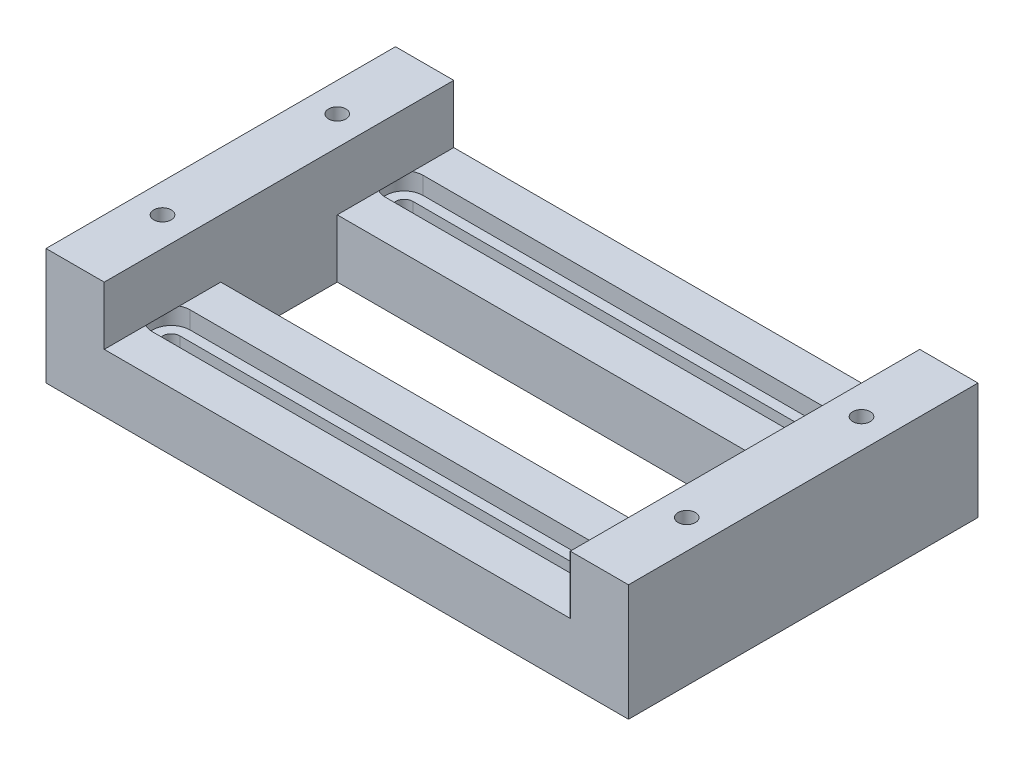
from build123d import *

# Parameters (mm, degrees)
SKETCH1_R             = 1.5
BOSS_EXTRUDE1_DEPTH   = 10
CUT_SLOT_INSETS_DEPTH = 3
SKETCH5_W             = 10
SKETCH5_H             = 60
SKETCH5_R             = 1.5
BOSS_EXTRUDE3_DEPTH   = 10
SKETCH6_R             = 3.75
CUT_EXTRUDE1_DEPTH    = 2.5


with BuildPart() as part:
    # Sketch1 → Boss-Extrude1 (new body)
    with BuildSketch(Plane(origin=(0, 0, 0), x_dir=(1, 0, 0), z_dir=(0, 1, 0))):
        Polygon((100, 60), (50, 60), (0, 60), (0, 0), (100, 0), align=None)
        with Locations((5, 15)):
            Circle(SKETCH1_R, mode=Mode.SUBTRACT)
        with BuildLine():
            ThreePointArc((11.5, 8.5), (10, 10), (11.5, 11.5))
            Line((11.5, 11.5), (88.5, 11.5))
            ThreePointArc((88.5, 11.5), (90, 10), (88.5, 8.5))
            Line((88.5, 8.5), (11.5, 8.5))
        make_face(mode=Mode.SUBTRACT)
        Polygon((10, 20), (10, 40), (50, 40), (90, 40), (90, 20), align=None, mode=Mode.SUBTRACT)
        with Locations((95, 15)):
            Circle(SKETCH1_R, mode=Mode.SUBTRACT)
        with Locations((5, 45)):
            Circle(SKETCH1_R, mode=Mode.SUBTRACT)
        with BuildLine():
            Line((88.5, 48.5), (50, 48.5))
            Line((50, 48.5), (11.5, 48.5))
            ThreePointArc((11.5, 48.5), (10, 50), (11.5, 51.5))
            Line((11.5, 51.5), (50, 51.5))
            Line((50, 51.5), (88.5, 51.5))
            ThreePointArc((88.5, 51.5), (90, 50), (88.5, 48.5))
        make_face(mode=Mode.SUBTRACT)
        with Locations((95, 45)):
            Circle(SKETCH1_R, mode=Mode.SUBTRACT)
    extrude(amount=BOSS_EXTRUDE1_DEPTH)

    # Sketch3 → Cut-Slot insets (cut)
    with BuildSketch(Plane(origin=(0, 10, 0), x_dir=(1, 0, 0), z_dir=(0, 1, 0))):
        with BuildLine():
            Line((88.5, 13.25), (11.5, 13.25))
            ThreePointArc((11.5, 13.25), (8.25, 10), (11.5, 6.75))
            Line((11.5, 6.75), (88.5, 6.75))
            ThreePointArc((88.5, 6.75), (91.75, 10), (88.5, 13.25))
        make_face()
        with BuildLine():
            Line((88.5, 53.25), (11.5, 53.25))
            ThreePointArc((11.5, 53.25), (8.25, 50), (11.5, 46.75))
            Line((11.5, 46.75), (88.5, 46.75))
            ThreePointArc((88.5, 46.75), (91.75, 50), (88.5, 53.25))
        make_face()
    extrude(amount=-CUT_SLOT_INSETS_DEPTH, mode=Mode.SUBTRACT)

    # Sketch5 → Boss-Extrude3 (add)
    # profile 1 of 2: a face of its own
    with BuildSketch(Plane(origin=(0, 10, 0), x_dir=(1, 0, 0), z_dir=(0, 1, 0))):
        with Locations((5, 30)):
            Rectangle(SKETCH5_W, SKETCH5_H)
        with Locations((5, 15)):
            Circle(SKETCH5_R, mode=Mode.SUBTRACT)
        with Locations((5, 45)):
            Circle(SKETCH5_R, mode=Mode.SUBTRACT)
    # profile 2 of 2: a face of its own
    with BuildSketch(Plane(origin=(0, 10, 0), x_dir=(1, 0, 0), z_dir=(0, 1, 0))):
        with Locations((95, 30)):
            Rectangle(SKETCH5_W, SKETCH5_H)
        with Locations((95, 45)):
            Circle(SKETCH5_R, mode=Mode.SUBTRACT)
        with Locations((95, 15)):
            Circle(SKETCH5_R, mode=Mode.SUBTRACT)
    extrude(amount=BOSS_EXTRUDE3_DEPTH)

    # Sketch6 → Cut-Extrude1 (cut)
    with BuildSketch(Plane.XZ):
        with Locations((5, -45)):
            Circle(SKETCH6_R)
        with Locations((5, -15)):
            Circle(SKETCH6_R)
        with Locations((95, -15)):
            Circle(SKETCH6_R)
        with Locations((95, -45)):
            Circle(SKETCH6_R)
    extrude(amount=-CUT_EXTRUDE1_DEPTH, mode=Mode.SUBTRACT)


solid = part.part
